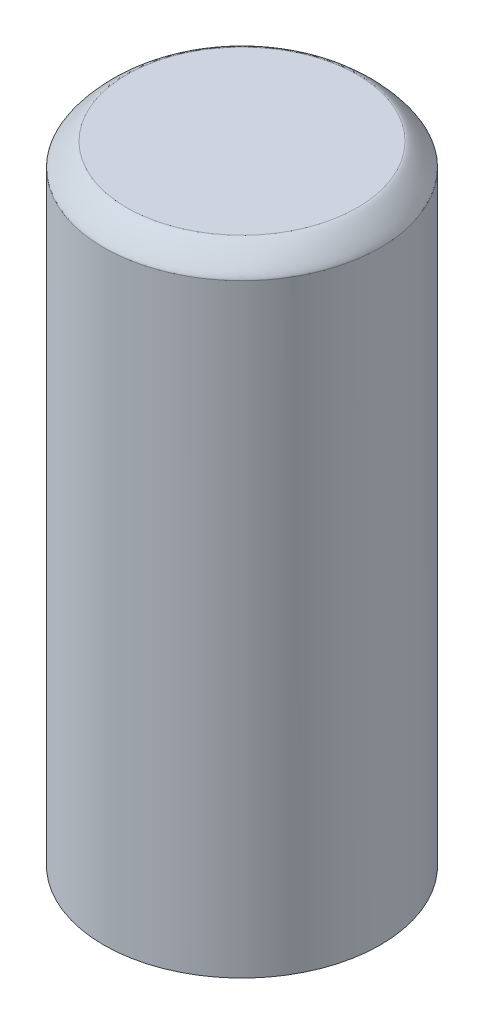
from build123d import *

# Parameters (mm, degrees)
SKETCH1_R           = 3
BOSS_EXTRUDE1_DEPTH = 13.6
FILLET1_SIZE        = 0.5


with BuildPart() as part:
    # Sketch1 → Boss-Extrude1 (new body)
    with BuildSketch(Plane(origin=(0, 0, 0), x_dir=(1, 0, 0), z_dir=(0, 1, 0))):
        with Locations(Location((0, 0, 0), (0, 0, 270))):
            Circle(SKETCH1_R)
    extrude(amount=BOSS_EXTRUDE1_DEPTH)

    # Fillet1
    # a fillet whose section is not a circle: 0.5 mm, written as the material it takes off along each edge
    with BuildSketch(Plane(origin=(0, 13.6, 0), x_dir=(0, 0, 1), z_dir=(-1, 0, 0))) as fillet1_piece_1:
        with BuildLine():
            Bezier((3, -FILLET1_SIZE), (3, 0), (3 - FILLET1_SIZE, 0), weights=[1, 0.176776695, 1])
            Line((3 - FILLET1_SIZE, 0), (3, 0))
            Line((3, 0), (3, -FILLET1_SIZE))
        make_face()
    revolve(axis=Axis((0, 13.6, 0), (0, 1, 0)), mode=Mode.SUBTRACT)


solid = part.part
